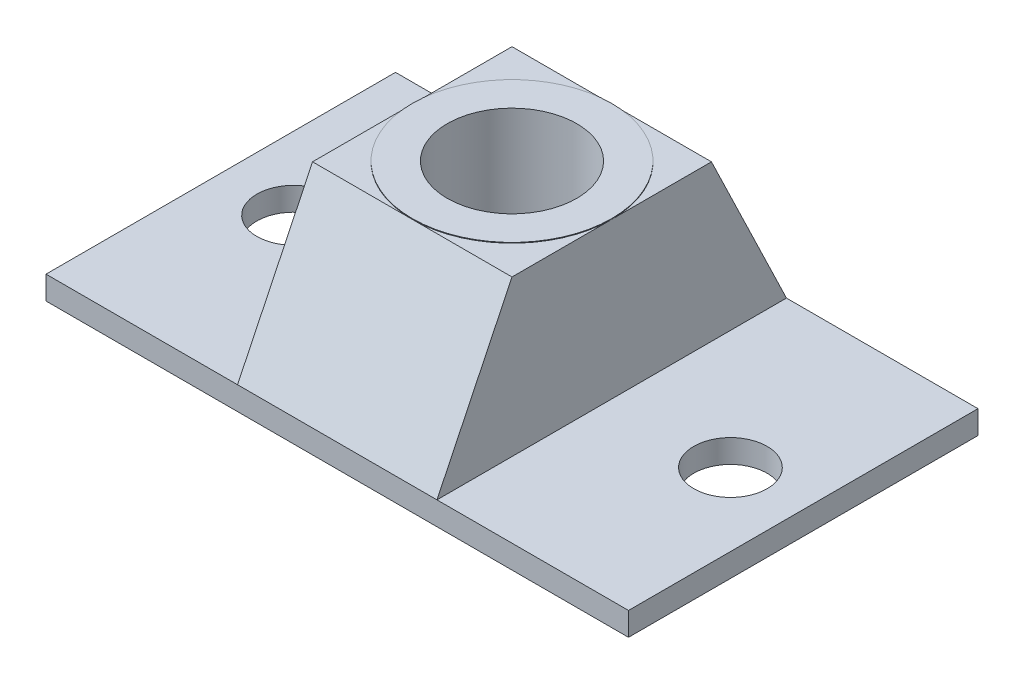
from build123d import *

# Parameters (mm, degrees)
SKETCH1_R           = 8.56
SKETCH1_R_2         = 5.56
BOSS_EXTRUDE1_DEPTH = 15.41
SKETCH1_3_W         = 50
SKETCH1_3_H         = 30
BOSS_EXTRUDE2_DEPTH = 2
SKETCH1_4_R         = 5.56
CUT_EXTRUDE1_DEPTH  = 2
SKETCH1_5_R         = 3.15
CUT_EXTRUDE2_DEPTH  = 2
SKETCH2_W           = 17.12
SKETCH2_H           = 30
BOSS_EXTRUDE3_DEPTH = 13.35
CUT_EXTRUDE3_START  = -13.35
SKETCH3_R           = 5.56
CUT_EXTRUDE3_DEPTH  = 13.35
CUT_EXTRUDE4_DEPTH  = 18.35


with BuildPart() as part:
    # Sketch1 → Boss-Extrude1 (new body)
    with BuildSketch(Plane(origin=(0, 0, 0), x_dir=(1, 0, 0), z_dir=(0, 1, 0))):
        Circle(SKETCH1_R)
        Circle(SKETCH1_R_2, mode=Mode.SUBTRACT)
    extrude(amount=BOSS_EXTRUDE1_DEPTH)



with BuildPart() as body_2:
    # Sketch1<3> → Boss-Extrude2 (new body)
    with BuildSketch(Plane(origin=(0, 0, 0), x_dir=(1, 0, 0), z_dir=(0, 1, 0))):
        Rectangle(SKETCH1_3_W, SKETCH1_3_H)
    extrude(amount=BOSS_EXTRUDE2_DEPTH)

    # Sketch1<4> → Cut-Extrude1 (cut)
    with BuildSketch(Plane(origin=(0, 0, 0), x_dir=(1, 0, 0), z_dir=(0, 1, 0))):
        Circle(SKETCH1_4_R)
    extrude(amount=CUT_EXTRUDE1_DEPTH, mode=Mode.SUBTRACT)

    # Sketch1<5> → Cut-Extrude2 (cut)
    with BuildSketch(Plane(origin=(0, 0, 0), x_dir=(1, 0, 0), z_dir=(0, 1, 0))):
        with Locations((-18.75, 0)):
            Circle(SKETCH1_5_R)
        with Locations((18.75, 0)):
            Circle(SKETCH1_5_R)
    extrude(amount=CUT_EXTRUDE2_DEPTH, mode=Mode.SUBTRACT)


with BuildPart() as part_1:
    add(part.part)

    add(body_2.part)  # Boss-Extrude3 merges body 2
    # Sketch2 → Boss-Extrude3 (add)
    with BuildSketch(Plane(origin=(0, 2, 0), x_dir=(1, 0, 0), z_dir=(0, 1, 0))):
        Rectangle(SKETCH2_W, SKETCH2_H)
    extrude(amount=BOSS_EXTRUDE3_DEPTH)

    # Sketch3 → Cut-Extrude3 (cut)
    with BuildSketch(Plane(origin=(0, 15.35, 0), x_dir=(1, 0, 0), z_dir=(0, 1, 0)).offset(CUT_EXTRUDE3_START)):
        Circle(SKETCH3_R)
    extrude(amount=CUT_EXTRUDE3_DEPTH, mode=Mode.SUBTRACT)

    # Sketch4 → Cut-Extrude4 (cut)
    with BuildSketch(Plane.ZY.offset(8.56)):
        Polygon((-15, 2), (-8.56, 15.35), (-15, 15.35), align=None)
        Polygon((15, 15.35), (8.56, 15.35), (15, 2), align=None)
    extrude(amount=-CUT_EXTRUDE4_DEPTH, mode=Mode.SUBTRACT)


solid = part_1.part
